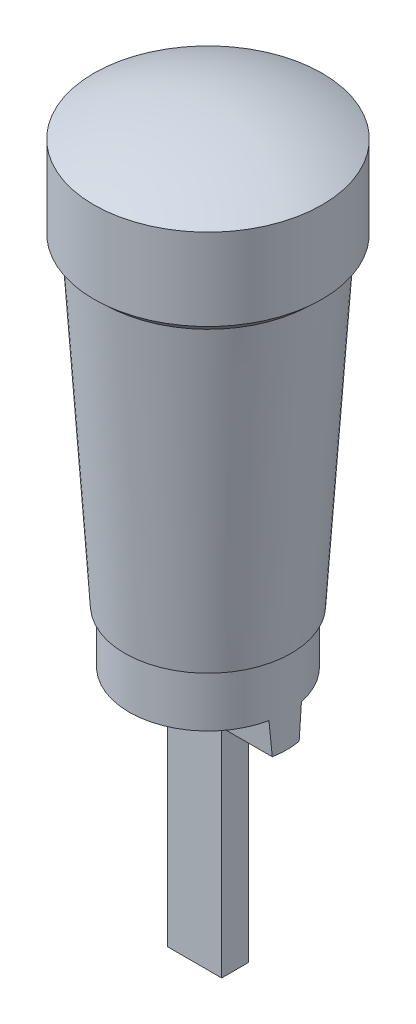
from build123d import *

# Parameters (mm, degrees)
CUT_EXTRUDE1_DEPTH       = 12
CUT_EXTRUDE1_DEPTH_BACK  = 12
BOSS_EXTRUDE1_DEPTH      = 1.27
BOSS_EXTRUDE1_DEPTH_BACK = 1.27
SKETCH3_W                = 1.257334554
SKETCH3_H                = 10.16


with BuildPart() as part:
    # Sketch1 → Revolve1 (revolve)
    with BuildSketch(Plane(origin=(0, 0, 0), x_dir=(0, 0, -1), z_dir=(1, 0, 0))):
        with BuildLine():
            Line((5.3467, 29.6164), (5.3467, 25.787746778))
            Line((5.3467, 25.787746778), (4.839751483, 25.315967815))
            Line((4.839751483, 25.315967815), (3.898985355, 10.6934))
            Line((3.898985355, 10.6934), (3.6957, 10.6934))
            Line((3.6957, 10.6934), (3.6957, 6.2738))
            Line((3.6957, 6.2738), (0, 6.2738))
            Line((0, 6.2738), (0, 30.8864))
            ThreePointArc((0, 30.8864), (2.747730923, 30.564543684), (5.3467, 29.6164))
        make_face()
    revolve(axis=Axis((0, 6.2738, 0), (0, 1, 0)))

    # Sketch2 → Cut-Extrude1 (cut, two sides: drawn at the far end of the back side and taken through both)
    with BuildSketch(Plane(origin=(0, 0, 0), x_dir=(0, 0, -1), z_dir=(1, 0, 0)).offset(-CUT_EXTRUDE1_DEPTH_BACK)):
        Polygon((-3.6957, 5.1562), (3.6957, 5.1562), (3.6957, 8.2042), (0.762, 8.2042), (0.628667277, 6.6802), (-0.628667277, 6.6802), (-0.762, 8.2042), (-3.6957, 8.2042), align=None)
    extrude(amount=CUT_EXTRUDE1_DEPTH + CUT_EXTRUDE1_DEPTH_BACK, mode=Mode.SUBTRACT)

    # Sketch3 → Boss-Extrude1 (add, two sides: drawn at the far end of the back side and taken through both)
    with BuildSketch(Plane(origin=(0, 0, 0), x_dir=(0, 0, -1), z_dir=(1, 0, 0)).offset(-BOSS_EXTRUDE1_DEPTH_BACK)):
        with Locations((0, 1.6002)):
            Rectangle(SKETCH3_W, SKETCH3_H)
    extrude(amount=BOSS_EXTRUDE1_DEPTH + BOSS_EXTRUDE1_DEPTH_BACK)


solid = part.part
